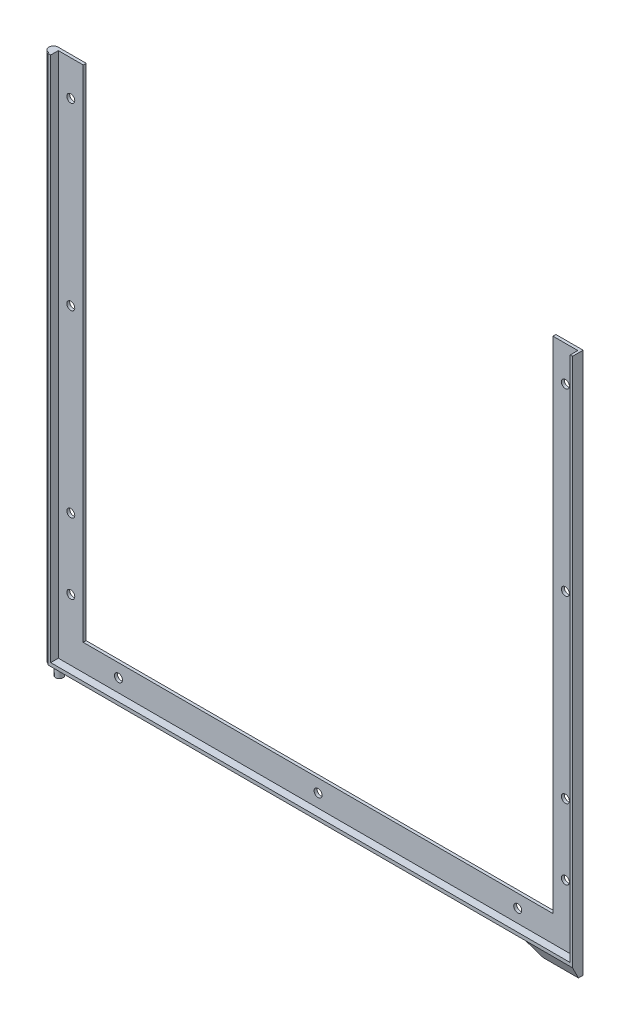
from build123d import *

# Parameters (mm, degrees)
SALIENTE_EXTRUIR1_DEPTH = 1.25
SALIENTE_EXTRUIR2_DEPTH = 3.25
SALIENTE_EXTRUIR3_DEPTH = 5
SALIENTE_EXTRUIR4_DEPTH = 225.499987602
SALIENTE_EXTRUIR6_REACH = 368.413
CROQUIS6_W              = 4.5
CROQUIS6_H              = 225.499987602
CHAFL_N1_SIZE           = 0.6
CHAFL_N1_SIZE_2         = 0.279784595
REDONDEO1_R             = 0.5
CORTAR_EXTRUIR1_REACH   = 369.581
CROQUIS8_R              = 1.7
CORTAR_EXTRUIR2_DEPTH   = 409.723751009


with BuildPart() as part:
    # Croquis1 → Saliente-Extruir1 (new body)
    with BuildSketch(Plane.XY):
        Polygon((287.750005722, 59.751000255), (272.747904062, 59.751000255), (267.749905586, 64.749002457), (64.157357861, 64.749002457), (64.553998411, 290.248990059), (76.149903238, 290.248990059), (76.149903238, 77.348701656), (276.148021221, 77.348701656), (276.148021221, 290.248990059), (287.750005722, 290.248990059), align=None)
    extrude(amount=SALIENTE_EXTRUIR1_DEPTH)

    # Croquis2 → Saliente-Extruir2 (add)
    with BuildSketch(Plane.XY.offset(1.25)):
        Polygon((286.75003751, 290.248990059), (287.750005722, 290.248990059), (287.750005722, 59.751000255), (272.747904062, 59.751000255), (267.749905586, 64.749002457), (64.157357861, 64.749002457), (64.553998411, 290.248990059), (65.547994841, 290.248990059), (65.547994841, 66.199905073), (286.75003751, 66.199905073), align=None)
    extrude(amount=SALIENTE_EXTRUIR2_DEPTH)

    # Croquis3 → Saliente-Extruir3 (add)
    with BuildSketch(Plane.XZ.offset(-64.749002457)):
        with BuildLine():
            Line((64.515409591, 0), (66.982480076, 0))
            ThreePointArc((66.982480076, 0), (65.748944833, 2.619014625), (64.515409591, 0))
        make_face()
    extrude(amount=SALIENTE_EXTRUIR3_DEPTH)

    # Saliente-Extruir6: up to this face of the body (flat: up to its plane)
    saliente_extruir6_end = Plane(part.part.faces().sort_by_distance((64.355678136, 177.498996258, 2.25))[0])
    # Croquis6 → Saliente-Extruir6 (add, up to the picked face)
    with BuildSketch(Plane(origin=(64.157357861, 0, 0), x_dir=(0, 0, -1), z_dir=(1, 0, 0)), mode=Mode.PRIVATE) as saliente_extruir6_sk1:
        with Locations((-2.25, 177.498996258)):
            Rectangle(CROQUIS6_W, CROQUIS6_H)
    saliente_extruir6_tool1 = split(extrude(saliente_extruir6_sk1.sketch, amount=SALIENTE_EXTRUIR6_REACH, mode=Mode.PRIVATE), bisect_by=saliente_extruir6_end, keep=Keep.BOTH, mode=Mode.PRIVATE)


with BuildPart() as body_2:
    # Croquis3<3> → Saliente-Extruir4 (new body)
    with BuildSketch(Plane.XZ.offset(-64.749002457)):
        with BuildLine():
            Line((64.157357861, 3.992626763), (64.157357861, 0))
            ThreePointArc((64.157357861, 0), (62.24843494, 1.996313381), (64.157357861, 3.992626763))
        make_face()
    extrude(amount=-SALIENTE_EXTRUIR4_DEPTH)


with BuildPart() as part_1:
    add(part.part)

    add(body_2.part)  # Saliente-Extruir6 merges body 2
    add(saliente_extruir6_tool1.solids().sort_by(Axis((64.157358, 177.498996, 2.25), (1, 0, 0)))[0])

    # Chaflán1
    # the kernel refuses this chamfer: 0.6, 0.279784595 mm, written as the material it takes off along each edge
    with BuildSketch(Plane(origin=(64.157357861, 63.194417174, 4.5), x_dir=(-0.016311164131115618, 0, -0.9998669641130703), z_dir=(0, 1, 0))) as chafl_n1_piece_1_section:
        Polygon((CHAFL_N1_SIZE * 0.999866964113, -CHAFL_N1_SIZE * 0.0163111641311), (-CHAFL_N1_SIZE_2 * 0.0163111641249, -CHAFL_N1_SIZE_2 * 0.999866963731), (0, 0), align=None)
    chafl_n1_piece_1 = extrude(amount=228.609158168, mode=Mode.PRIVATE)
    chafl_n1_piece_1 = chafl_n1_piece_1 - Plane(origin=(64.246748688, 177.498996258, 1.996313381), x_dir=(-0.044733129364357686, 0, -0.9989989725406486), z_dir=(0, -1, 0)) * Cylinder(1.998313748, 460, mode=Mode.PRIVATE)
    add(chafl_n1_piece_1, mode=Mode.SUBTRACT)

    # Redondeo1
    redondeo1_edges = [part_1.edges().sort_by_distance(p)[0] for p in [
        (65.748944833, 64.749002457, 2.619014625),
    ]]
    fillet(redondeo1_edges, radius=REDONDEO1_R)

    # Cortar-Extruir1: up to this plane
    cortar_extruir1_end = Plane(origin=(272.747904062, 59.751000255, 1.25), z_dir=(0.7071070447096931, 0.7071065176633039, 0))
    # Croquis7 → Cortar-Extruir1 (cut, up to the surface)
    with BuildSketch(Plane(origin=(287.750005722, 0, 0), x_dir=(0, 0, -1), z_dir=(1, 0, 0)), mode=Mode.PRIVATE) as cortar_extruir1_sk1:
        Polygon((-2, 59.751000255), (-4.5, 64.749002457), (-4.5, 59.751000255), align=None)
    cortar_extruir1_tool1 = split(extrude(cortar_extruir1_sk1.sketch, amount=-CORTAR_EXTRUIR1_REACH, mode=Mode.PRIVATE), bisect_by=cortar_extruir1_end, keep=Keep.BOTH, mode=Mode.PRIVATE)
    add(cortar_extruir1_tool1.solids().sort_by_distance((287.750006, 61.417001, 3.666667))[0], mode=Mode.SUBTRACT)

    # Croquis8 → Cortar-Extruir2 (cut, through all)
    with BuildSketch(Plane.XY.offset(1.25)):
        with Locations((176.148989202, 71.774303364)):
            Circle(CROQUIS8_R)
        with Locations((91.149903238, 71.774303364)):
            Circle(CROQUIS8_R)
        with Locations(Location((261.148075163, 71.775125937, 0), (0, 0, 180))):
            Circle(CROQUIS8_R)
        with Locations((70.848949039, 92.348701656)):
            Circle(CROQUIS8_R)
        with Locations((70.848949039, 122.348701656)):
            Circle(CROQUIS8_R)
        with Locations((70.848949039, 275.248990059)):
            Circle(CROQUIS8_R)
        with Locations((70.848949039, 198.798845857)):
            Circle(CROQUIS8_R)
        with Locations(Location((281.44853993, 122.349720687, 0), (0, 0, 180))):
            Circle(CROQUIS8_R)
        with Locations(Location((281.447800089, 198.799864885, 0), (0, 0, 180))):
            Circle(CROQUIS8_R)
        with Locations(Location((281.447060248, 275.250009083, 0), (0, 0, 180))):
            Circle(CROQUIS8_R)
        with Locations(Location((281.448830253, 92.349720689, 0), (0, 0, 180))):
            Circle(CROQUIS8_R)
    extrude(amount=-CORTAR_EXTRUIR2_DEPTH, mode=Mode.SUBTRACT)


solid = part_1.part
